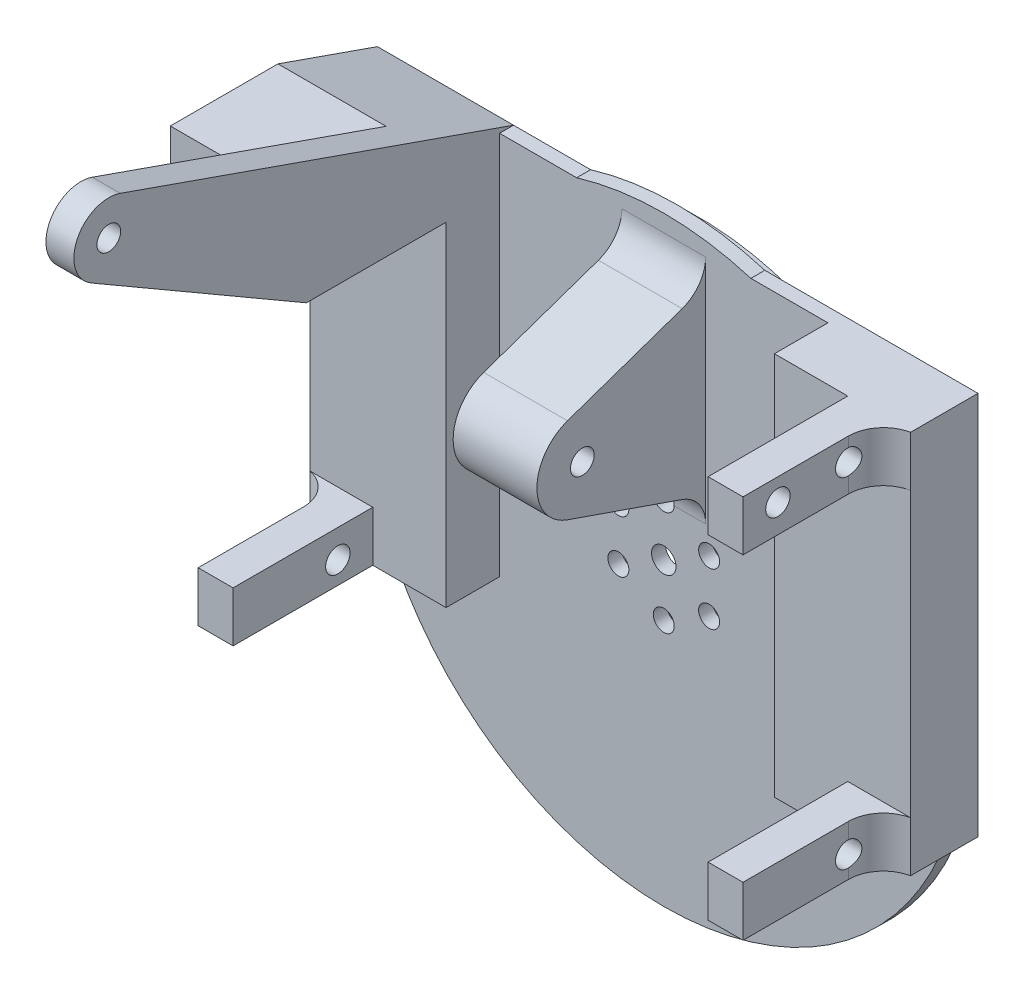
from build123d import *

# Parameters (mm, degrees)
SKETCH_2_R             = 40
EXTRUDE_1_DEPTH        = 3
SKETCH_3_R             = 43
SKETCH_3_R_2           = 1.5
SKETCH_3_R_3           = 1.75
EXTRUDE_2_DEPTH        = 2
SKETCH_4_R             = 1.7
EXTRUDE_3_DEPTH        = 6
SKETCH_6_W             = 19.489388493
SKETCH_6_H             = 55
EXTRUDE_4_DEPTH        = 9.662698808
SKETCH_7_W             = 5
SKETCH_7_H             = 7.2
EXTRUDE_5_DEPTH        = 20
FILLET_1_R             = 5
SKETCH_8_R             = 1.75
CUT_EXTRUDE_1_DEPTH    = 8
FILLET_1_OF_MIRROR_1_R = 5
FILLET_2_R             = 5
SKETCH_10_R            = 5
SKETCH_10_R_2          = 1.7
EXTRUDE_6_DEPTH        = 4
EXTRUDE_7_DEPTH        = 15.489388493
SKETCH_13_W            = 48.978361992
SKETCH_13_H            = 5.952940671
EXTRUDE_8_DEPTH        = 2


with BuildPart() as part:
    # 草图2 → 凸台-拉伸1 (new body)
    with BuildSketch(Plane.XY):
        Circle(SKETCH_2_R)
        with BuildLine():
            Line((-3.843778342, 6.657619381), (-10.418112816, 9.210167583))
            ThreePointArc((-10.418112816, 9.210167583), (-13.856406461, 8), (-13.185295508, 4.417266567))
            Line((-13.185295508, 4.417266567), (-7.687556684, 0))
            Line((-7.687556684, 0), (-13.185295508, -4.417266567))
            ThreePointArc((-13.185295508, -4.417266567), (-13.856406461, -8), (-10.418112816, -9.210167583))
            Line((-10.418112816, -9.210167583), (-3.843778342, -6.657619381))
            Line((-3.843778342, -6.657619381), (-2.767182691, -13.62743415))
            ThreePointArc((-2.767182691, -13.62743415), (0, -16), (2.767182691, -13.62743415))
            Line((2.767182691, -13.62743415), (3.843778342, -6.657619381))
            Line((3.843778342, -6.657619381), (10.418112816, -9.210167583))
            ThreePointArc((10.418112816, -9.210167583), (13.856406461, -8), (13.185295508, -4.417266567))
            Line((13.185295508, -4.417266567), (7.687556684, 0))
            Line((7.687556684, 0), (13.185295508, 4.417266567))
            ThreePointArc((13.185295508, 4.417266567), (13.856406461, 8), (10.418112816, 9.210167583))
            Line((10.418112816, 9.210167583), (3.843778342, 6.657619381))
            Line((3.843778342, 6.657619381), (2.767182691, 13.62743415))
            ThreePointArc((2.767182691, 13.62743415), (0, 16), (-2.767182691, 13.62743415))
            Line((-2.767182691, 13.62743415), (-3.843778342, 6.657619381))
        make_face(mode=Mode.SUBTRACT)
    extrude(amount=-EXTRUDE_1_DEPTH)

    # 草图3 → 凸台-拉伸2 (add)
    with BuildSketch(Plane.XY):
        Circle(SKETCH_3_R)
        with Locations((0, -7.5)):
            Circle(SKETCH_3_R_2, mode=Mode.SUBTRACT)
        with Locations((-6.495190528, -3.75)):
            Circle(SKETCH_3_R_2, mode=Mode.SUBTRACT)
        with Locations((-6.495190528, 3.75)):
            Circle(SKETCH_3_R_2, mode=Mode.SUBTRACT)
        with Locations((0, 7.5)):
            Circle(SKETCH_3_R_2, mode=Mode.SUBTRACT)
        with Locations((6.495190528, 3.75)):
            Circle(SKETCH_3_R_2, mode=Mode.SUBTRACT)
        with Locations((6.495190528, -3.75)):
            Circle(SKETCH_3_R_2, mode=Mode.SUBTRACT)
        Circle(SKETCH_3_R_3, mode=Mode.SUBTRACT)
    extrude(amount=EXTRUDE_2_DEPTH)

    # 草图4 → 凸台-拉伸3 (add, symmetric)
    with BuildSketch(Plane(origin=(0, 0, 0), x_dir=(0, 0, -1), z_dir=(1, 0, 0))):
        with BuildLine():
            Line((-21.791018214, 17.858318105), (-2, 11))
            Line((-2, 11), (-2, 37))
            Line((-2, 37), (-21.791018214, 30.141681895))
            ThreePointArc((-21.791018214, 30.141681895), (-26.162698808, 24), (-21.791018214, 17.858318105))
        make_face()
        with Locations((-19.662698808, 24)):
            Circle(SKETCH_4_R, mode=Mode.SUBTRACT)
    extrude(amount=EXTRUDE_3_DEPTH, both=True)

    # 草图6 → 凸台-拉伸4 (add)
    with BuildSketch(Plane(origin=(0, 0, 0), x_dir=(-1, 0, 0), z_dir=(0, 0, -1))):
        with Locations((33.255305753, 13.65)):
            Rectangle(SKETCH_6_W, SKETCH_6_H)
    extrude_4 = extrude(amount=-EXTRUDE_4_DEPTH)

    # 草图7 → 凸台-拉伸5 (add)
    with BuildSketch(Plane.XY.offset(9.662698808)):
        with Locations((-36.510611507, 37.55)):
            Rectangle(SKETCH_7_W, SKETCH_7_H)
        with Locations((-36.510611507, -10.25)):
            Rectangle(SKETCH_7_W, SKETCH_7_H)
    extrude_5 = extrude(amount=EXTRUDE_5_DEPTH)

    # 圆角1
    # the kernel refuses this fillet: 5 mm, written as the material it adds along each edge
    with BuildSketch(Plane(origin=(-39.010611507, -13.85, 9.662698808), x_dir=(-1.0, 0, 9.057736173164017e-11), z_dir=(0, 1, 0)), Plane(origin=(-39.010611507, 33.95, 9.662698808), x_dir=(-1.0, 0, 9.057736173164017e-11), z_dir=(0, 1, 0))) as fillet_1_piece_1:
        with BuildLine():
            CenterArc((5, 4.896801444), FILLET_1_R, 179.999999995, 78.338907052)
            Line((0, 4.896801444), (-0.1, 4.896801444))
            Line((-0.1, 4.896801444), (-0.1, 0))
            Line((-0.1, 0), (0, -0.1))
            ThreePointArc((0, -0.1), (1.994694247, -0.1), (3.969176263, -0.097936029))
            Line((3.969176263, -0.097936029), (3.989388493, 0))
        make_face()
    extrude(amount=7.2)

    # 草图8 → 切除-拉伸1 (cut)
    with BuildSketch(Plane(origin=(-34.010611507, 0, 0), x_dir=(0, 0, -1), z_dir=(1, 0, 0))):
        with Locations((-14.662698808, 37.965)):
            Circle(SKETCH_8_R)
        with Locations((-24.662698808, 37.965)):
            Circle(SKETCH_8_R)
        with Locations((-14.662698808, -10.665)):
            Circle(SKETCH_8_R)
        with Locations((24.662698808, -10.665)):
            Circle(SKETCH_8_R)
    cut_extrude_1 = extrude(amount=-CUT_EXTRUDE_1_DEPTH, mode=Mode.SUBTRACT)

    # 镜向1: 凸台-拉伸4, 凸台-拉伸5, 切除-拉伸1 across plane
    add(extrude_4.mirror(Plane(origin=(0, 0, 0), x_dir=(0, 0, 1), z_dir=(1, 0, 0))))
    add(extrude_5.mirror(Plane(origin=(0, 0, 0), x_dir=(0, 0, 1), z_dir=(1, 0, 0))))
    add(cut_extrude_1.mirror(Plane(origin=(0, 0, 0), x_dir=(0, 0, 1), z_dir=(1, 0, 0))), mode=Mode.SUBTRACT)

    # 圆角1 of 镜向1
    # the kernel refuses this fillet: 5 mm, written as the material it adds along each edge
    with BuildSketch(Plane(origin=(39.010611507, -13.85, 9.662698808), x_dir=(1.0, 0, 9.057736173164017e-11), z_dir=(0, 1, 0))) as fillet_1_of_mirror_1_piece_1_section:
        with BuildLine():
            CenterArc((5, -4.896801444), FILLET_1_OF_MIRROR_1_R, 101.661092954, 78.338907052)
            Line((0, -4.896801444), (-0.1, -4.896801444))
            Line((-0.1, -4.896801444), (-0.1, 0))
            Line((-0.1, 0), (0, 0.1))
            ThreePointArc((0, 0.1), (1.994694247, 0.1), (3.969176263, 0.097936029))
            Line((3.969176263, 0.097936029), (3.989388493, 0))
        make_face()
    fillet_1_of_mirror_1_piece_1 = extrude(amount=7.2, mode=Mode.PRIVATE)
    fillet_1_of_mirror_1_piece_1 = fillet_1_of_mirror_1_piece_1 - Plane(origin=(40.024571276, -10.665, 14.662698808), x_dir=(0, 0, -1), z_dir=(-1, 0, 0)) * Cylinder(1.75, 34, mode=Mode.PRIVATE)
    add(fillet_1_of_mirror_1_piece_1)
    with BuildSketch(Plane(origin=(39.010611507, 33.95, 9.662698808), x_dir=(1.0, 0, 9.057736173164017e-11), z_dir=(0, 1, 0))) as fillet_1_of_mirror_1_piece_2_section:
        with BuildLine():
            CenterArc((5, -4.896801444), FILLET_1_OF_MIRROR_1_R, 101.661092954, 78.338907052)
            Line((0, -4.896801444), (-0.1, -4.896801444))
            Line((-0.1, -4.896801444), (-0.1, 0))
            Line((-0.1, 0), (0, 0.1))
            ThreePointArc((0, 0.1), (1.994694247, 0.1), (3.969176263, 0.097936029))
            Line((3.969176263, 0.097936029), (3.989388493, 0))
        make_face()
    fillet_1_of_mirror_1_piece_2 = extrude(amount=7.2, mode=Mode.PRIVATE)
    fillet_1_of_mirror_1_piece_2 = fillet_1_of_mirror_1_piece_2 - Plane(origin=(40.024571271, 37.965, 14.662698808), x_dir=(0, 0, -1), z_dir=(-1, 0, 0)) * Cylinder(1.75, 34, mode=Mode.PRIVATE)
    add(fillet_1_of_mirror_1_piece_2)

    # 圆角2
    # the kernel refuses this fillet: 5 mm, written as the material it adds along each edge
    with BuildSketch(Plane(origin=(-6, 11, 2), x_dir=(0, -1, 0), z_dir=(1, 0, 0))) as fillet_2_piece_1_section:
        with BuildLine():
            CenterArc((FILLET_2_R * 0.711805115944, -FILLET_2_R), FILLET_2_R, 90, 70.886911337)
            Line((-FILLET_2_R * 0.233069021814, -FILLET_2_R * 0.672566245179), (0, 0))
            Line((0, 0), (FILLET_2_R * 0.711805115944, 0))
        make_face()
    fillet_2_piece_1 = extrude(amount=12, mode=Mode.PRIVATE)
    fillet_2_piece_1 = fillet_2_piece_1 - Plane(origin=(0, 7.5, 2.750651106), x_dir=(1, 0, 0), z_dir=(0, 0, -1)) * Cylinder(1.5, 39, mode=Mode.PRIVATE)
    add(fillet_2_piece_1)
    with BuildSketch(Plane(origin=(-6, 37, 2), x_dir=(0, 1, 0), z_dir=(1, 0, 0))) as fillet_2_piece_2:
        with BuildLine():
            CenterArc((FILLET_2_R * 0.711805115944, FILLET_2_R), FILLET_2_R, 199.113088663, 70.886911337)
            Line((-FILLET_2_R * 0.233069021814, FILLET_2_R * 0.672566245179), (0, 0))
            Line((0, 0), (FILLET_2_R * 0.711805115944, 0))
        make_face()
    extrude(amount=12)

    # 草图10 → 凸台-拉伸6 (add)
    # profile 1 of 2: a face of its own
    with BuildSketch(Plane(origin=(-23.510611507, 0, 0), x_dir=(0, 0, -1), z_dir=(1, 0, 0))):
        with BuildLine():
            Line((0, 41.15), (-56.313238783, 60.858696746))
            ThreePointArc((-56.313238783, 60.858696746), (-53.887028683, 59.032613027), (-52.964920964, 56.139380484))
            ThreePointArc((-52.964920964, 56.139380484), (-55.468901732, 51.806957606), (-60.472876161, 51.813856154))
            Line((-60.472876161, 51.813856154), (-29.662698808, 33.95))
            Line((-29.662698808, 33.95), (-9.662698808, 33.95))
            Line((-9.662698808, 33.95), (-9.662698808, 41.15))
            Line((-9.662698808, 41.15), (0, 41.15))
        make_face()
    # profile 2 of 2: a face of its own
    with BuildSketch(Plane(origin=(-23.510611507, 0, 0), x_dir=(0, 0, -1), z_dir=(1, 0, 0))):
        with Locations((-57.964920964, 56.139380484)):
            Circle(SKETCH_10_R)
        with Locations((-57.964920964, 56.139380484)):
            Circle(SKETCH_10_R_2, mode=Mode.SUBTRACT)
    extrude(amount=-EXTRUDE_6_DEPTH)

    # 草图11 → 凸台-拉伸7 (add)
    with BuildSketch(Plane.ZY.offset(43)):
        Polygon((0, 41.15), (29.662698808, 41.15), (29.662698808, 46.138093671), (14.25237364, 46.138093671), align=None)
    extrude(amount=-EXTRUDE_7_DEPTH)

    # 草图13 → 凸台-拉伸8 (add)
    with BuildSketch(Plane(origin=(0, 0, 0), x_dir=(-1, 0, 0), z_dir=(0, 0, -1))):
        with Locations((-0.978569489, 38.173529665)):
            Rectangle(SKETCH_13_W, SKETCH_13_H)
    extrude(amount=-EXTRUDE_8_DEPTH)


solid = part.part
